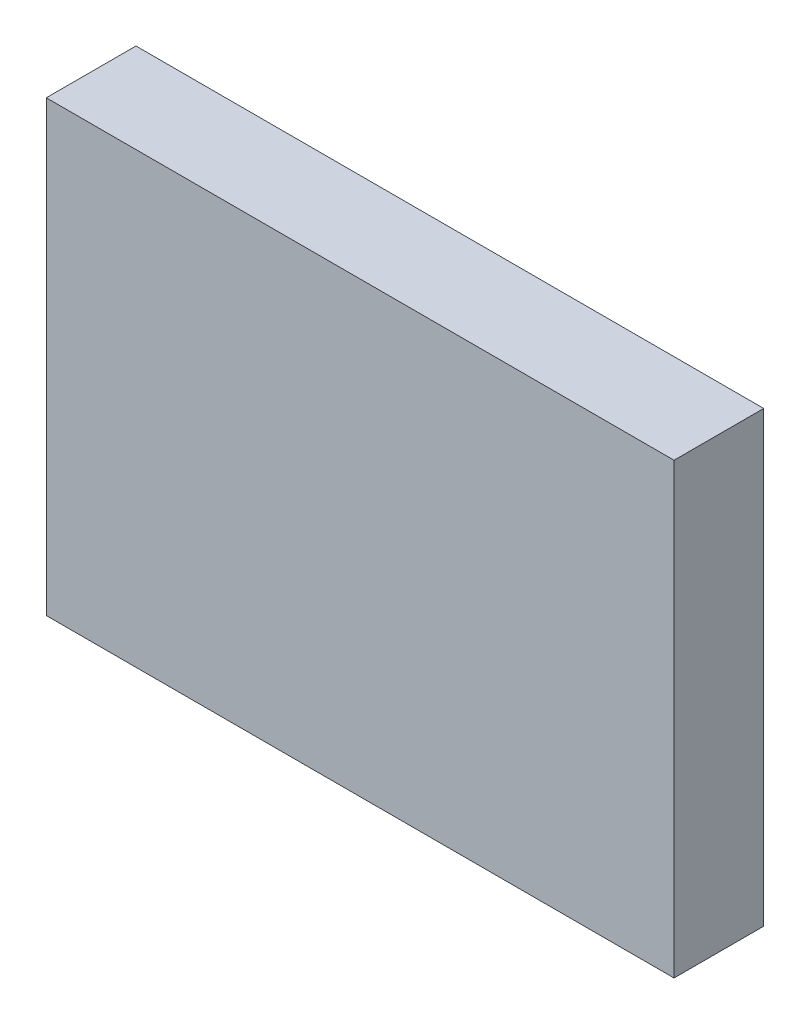
from build123d import *

# Parameters (mm, degrees)
SKETCH1_W           = 177.8
SKETCH1_H           = 127
BOSS_EXTRUDE1_DEPTH = 25.4


with BuildPart() as part:
    # Sketch1 → Boss-Extrude1 (new body)
    with BuildSketch(Plane.XY):
        Rectangle(SKETCH1_W, SKETCH1_H)
    extrude(amount=BOSS_EXTRUDE1_DEPTH)


solid = part.part
